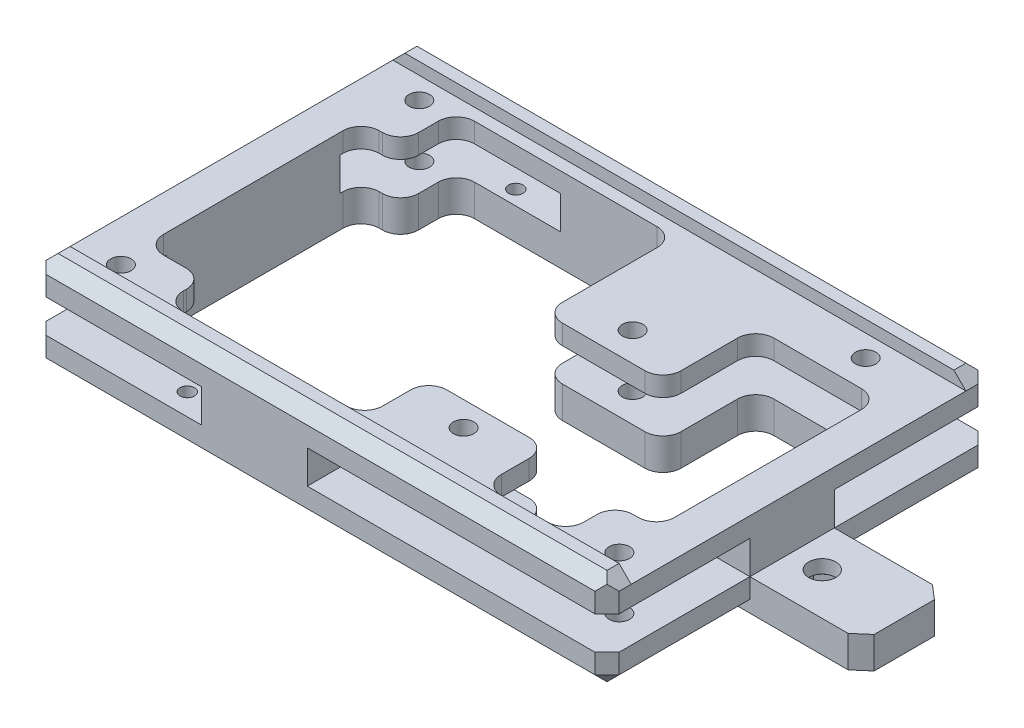
from build123d import *

# Parameters (mm, degrees)
SKETCH2_W                      = 95
SKETCH2_H                      = 63.5
BOSS_EXTRUDE1_DEPTH            = 16
M3_CLEARANCE_HOLE1_D           = 3.4
M3_CLEARANCE_HOLE1_CSINK_D     = 3.45
M3_CLEARANCE_HOLE1_CSINK_ANGLE = 90
CUT_EXTRUDE1_DEPTH             = 16
CUT_EXTRUDE2_DEPTH             = 2.4
FILLET2_SIZE                   = 2
CUT_EXTRUDE3_DEPTH             = 2.75
CUT_EXTRUDE3_DEPTH_BACK        = 2.75
SKETCH12_R                     = 1.7
CUT_EXTRUDE10_DEPTH            = 2.75
CUT_EXTRUDE10_DEPTH_BACK       = 2.75
CUT_EXTRUDE11_DEPTH            = 2.75
CUT_EXTRUDE11_DEPTH_BACK       = 2.75
CUT_EXTRUDE12_DEPTH            = 2.75
CUT_EXTRUDE12_DEPTH_BACK       = 2.75
SKETCH15_R                     = 1.7
CHAMFER1_SIZE                  = 2
CHAMFER2_SIZE                  = 2
SKETCH18_W                     = 17.545315541
SKETCH18_H                     = 5.5
BOSS_EXTRUDE2_DEPTH            = 6
SKETCH40_W                     = 124.310088306
SKETCH40_H                     = 55.5
CUT_EXTRUDE16_DEPTH            = 2
BOSS_EXTRUDE3_DEPTH            = 13.988796219
CUT_EXTRUDE18_DEPTH            = 3
M4_CLEARANCE_HOLE1_D           = 4.5
M4_CLEARANCE_HOLE1_CSINK_D     = 4.55
M4_CLEARANCE_HOLE1_CSINK_ANGLE = 90
BOSS_EXTRUDE4_DEPTH            = 5.25
BOSS_EXTRUDE5_DEPTH            = 13.988796219
M2_CLEARANCE_HOLE1_D           = 2.4
M2_CLEARANCE_HOLE1_DEPTH       = 5.25
M2_CLEARANCE_HOLE1_CSINK_D     = 2.45
M2_CLEARANCE_HOLE1_CSINK_ANGLE = 90
M2_CLEARANCE_HOLE1_TIP         = 0.721032743


with BuildPart() as part:
    # Sketch2 → Boss-Extrude1 (new body)
    with BuildSketch(Plane(origin=(0, 0, 0), x_dir=(1, 0, 0), z_dir=(0, 1, 0))):
        Rectangle(SKETCH2_W, SKETCH2_H)
    extrude(amount=BOSS_EXTRUDE1_DEPTH)

    # M3 Clearance Hole1 (through all)
    with Locations(Plane(origin=(0, 16, 0), x_dir=(1, 0, 0), z_dir=(0, 1, 0))):
        with Locations((-39.536732268, 24.17), (-40.666732268, -24.17), (34.463267732, 24.17), (41.963267732, -24.17), (11.143267732, -19.17), (11.143267732, 8.85)):
            CounterSinkHole(M3_CLEARANCE_HOLE1_D / 2, M3_CLEARANCE_HOLE1_CSINK_D / 2, counter_sink_angle=M3_CLEARANCE_HOLE1_CSINK_ANGLE)

    # Sketch9 → Cut-Extrude1 (cut)
    with BuildSketch(Plane(origin=(0, 16, 0), x_dir=(1, 0, 0), z_dir=(0, 1, 0))):
        with BuildLine():
            Line((-34.974163292, 19.487383717), (-34.974163292, 22.75))
            ThreePointArc((-34.974163292, 22.75), (-34.095483636, 24.871320344), (-31.974163292, 25.75))
            Line((-31.974163292, 25.75), (-1.684765082, 25.75))
            ThreePointArc((-1.684765082, 25.75), (0.436555262, 24.871320344), (1.315234918, 22.75))
            Line((1.315234918, 22.75), (1.315234918, 7.055031971))
            ThreePointArc((1.315234918, 7.055031971), (2.193914574, 4.933711628), (4.315234918, 4.055031971))
            Line((4.315234918, 4.055031971), (17.971300546, 4.055031971))
            ThreePointArc((17.971300546, 4.055031971), (20.09262089, 4.933711628), (20.971300546, 7.055031971))
            Line((20.971300546, 7.055031971), (20.971300546, 16.428287462))
            ThreePointArc((20.971300546, 16.428287462), (21.849980203, 18.549607805), (23.971300546, 19.428287462))
            Line((23.971300546, 19.428287462), (38.5, 19.428287462))
            ThreePointArc((38.5, 19.428287462), (40.621320344, 18.549607805), (41.5, 16.428287462))
            Line((41.5, 16.428287462), (41.5, -14.560508757))
            ThreePointArc((41.5, -14.560508757), (40.621320344, -16.681829101), (38.5, -17.560508757))
            Line((38.5, -17.560508757), (37.647901029, -17.560508757))
            ThreePointArc((37.647901029, -17.560508757), (35.526580685, -18.439188414), (34.647901029, -20.560508757))
            Line((34.647901029, -20.560508757), (34.647901029, -22.75))
            ThreePointArc((34.647901029, -22.75), (33.769221372, -24.871320344), (31.647901029, -25.75))
            Line((31.647901029, -25.75), (23.971300546, -25.75))
            ThreePointArc((23.971300546, -25.75), (21.849980203, -24.871320344), (20.971300546, -22.75))
            Line((20.971300546, -22.75), (20.971300546, -18.118028913))
            ThreePointArc((20.971300546, -18.118028913), (20.09262089, -15.996708569), (17.971300546, -15.118028913))
            Line((17.971300546, -15.118028913), (4.315234918, -15.118028913))
            ThreePointArc((4.315234918, -15.118028913), (2.193914574, -15.996708569), (1.315234918, -18.118028913))
            Line((1.315234918, -18.118028913), (1.315234918, -22.75))
            ThreePointArc((1.315234918, -22.75), (0.436555262, -24.871320344), (-1.684765082, -25.75))
            Line((-1.684765082, -25.75), (-28.730080623, -25.75))
            ThreePointArc((-28.730080623, -25.75), (-30.851400966, -24.871320344), (-31.730080623, -22.75))
            Line((-31.730080623, -22.75), (-31.730080623, -22.252488185))
            ThreePointArc((-31.730080623, -22.252488185), (-32.608760279, -20.131167841), (-34.730080623, -19.252488185))
            Line((-34.730080623, -19.252488185), (-38.5, -19.252488185))
            ThreePointArc((-38.5, -19.252488185), (-40.621320344, -18.373808528), (-41.5, -16.252488185))
            Line((-41.5, -16.252488185), (-41.5, 13.487383717))
            ThreePointArc((-41.5, 13.487383717), (-40.621320344, 15.60870406), (-38.5, 16.487383717))
            Line((-38.5, 16.487383717), (-37.974163292, 16.487383717))
            ThreePointArc((-37.974163292, 16.487383717), (-35.852842949, 17.366063373), (-34.974163292, 19.487383717))
        make_face()
    extrude(amount=-CUT_EXTRUDE1_DEPTH, mode=Mode.SUBTRACT)

    # Sketch10 → Cut-Extrude2 (cut)
    with BuildSketch(Plane.XZ):
        Polygon((-40.666732268, 20.994573519), (-37.916732268, 22.58228676), (-37.916732268, 25.75771324), (-40.666732268, 27.345426481), (-43.416732268, 25.75771324), (-43.416732268, 22.58228676), align=None)
        Polygon((-39.536732268, -27.345426481), (-36.786732268, -25.75771324), (-36.786732268, -22.58228676), (-39.536732268, -20.994573519), (-42.286732268, -22.58228676), (-42.286732268, -25.75771324), align=None)
        Polygon((8.393267732, -10.43771324), (11.143267732, -12.025426481), (13.893267732, -10.43771324), (13.893267732, -7.26228676), (11.143267732, -5.674573519), (8.393267732, -7.26228676), align=None)
        Polygon((8.393267732, 17.58228676), (11.143267732, 15.994573519), (13.893267732, 17.58228676), (13.893267732, 20.75771324), (11.143267732, 22.345426481), (8.393267732, 20.75771324), align=None)
        Polygon((41.963267732, 20.994573519), (44.713267732, 22.58228676), (44.713267732, 25.75771324), (41.963267732, 27.345426481), (39.213267732, 25.75771324), (39.213267732, 22.58228676), align=None)
    extrude(amount=-CUT_EXTRUDE2_DEPTH, mode=Mode.SUBTRACT)

    # Fillet2
    fillet2_edges = [part.edges().sort_by_distance(p)[0] for p in [
        (47.5, 16, 0),
        (0, 16, -31.75),
        (-47.5, 16, 0),
        (0, 16, 31.75),
    ]]
    chamfer(fillet2_edges, length=FILLET2_SIZE)

    # Sketch12 → Cut-Extrude3 (cut, two sides: drawn at the far end of the back side and taken through both)
    with BuildSketch(Plane(origin=(0, 8, 0), x_dir=(1, 0, 0), z_dir=(0, 1, 0)).offset(-CUT_EXTRUDE3_DEPTH_BACK)):
        with BuildLine():
            Line((-31.730080623, -22.252488185), (-31.730080623, -22.75))
            ThreePointArc((-31.730080623, -22.75), (-30.851400966, -24.871320344), (-28.730080623, -25.75))
            Line((-28.730080623, -25.75), (-19.730080623, -25.75))
            Line((-19.730080623, -25.75), (-19.730080623, -31.75))
            Line((-19.730080623, -31.75), (-47.5, -31.75))
            Line((-47.5, -31.75), (-47.5, -15.752488185))
            Line((-47.5, -15.752488185), (-41.5, -15.752488185))
            Line((-41.5, -15.752488185), (-41.5, -16.252488185))
            ThreePointArc((-41.5, -16.252488185), (-40.621320344, -18.373808528), (-38.5, -19.252488185))
            Line((-38.5, -19.252488185), (-34.730080623, -19.252488185))
            ThreePointArc((-34.730080623, -19.252488185), (-32.608760279, -20.131167841), (-31.730080623, -22.252488185))
        make_face()
        with Locations(Location((-40.666732268, -24.17, 0), (0, 0, 270))):
            Circle(SKETCH12_R, mode=Mode.SUBTRACT)
    extrude(amount=CUT_EXTRUDE3_DEPTH + CUT_EXTRUDE3_DEPTH_BACK, mode=Mode.SUBTRACT)

    # Sketch14 → Cut-Extrude10 (cut, two sides: drawn at the far end of the back side and taken through both)
    with BuildSketch(Plane(origin=(0, 8, 0), x_dir=(1, 0, 0), z_dir=(0, 1, 0)).offset(-CUT_EXTRUDE10_DEPTH_BACK)):
        with BuildLine():
            Line((-34.974163292, 22.75), (-34.974163292, 19.487383717))
            ThreePointArc((-34.974163292, 19.487383717), (-35.852842949, 17.366063373), (-37.974163292, 16.487383717))
            Line((-37.974163292, 16.487383717), (-38.5, 16.487383717))
            ThreePointArc((-38.5, 16.487383717), (-40.621320344, 15.60870406), (-41.5, 13.487383717))
            Line((-41.5, 13.487383717), (-41.5, 12.987383717))
            Line((-41.5, 12.987383717), (-47.5, 12.987383717))
            Line((-47.5, 12.987383717), (-47.5, 31.75))
            Line((-47.5, 31.75), (-11.974163292, 31.75))
            Line((-11.974163292, 31.75), (-11.974163292, 25.75))
            Line((-11.974163292, 25.75), (-31.974163292, 25.75))
            ThreePointArc((-31.974163292, 25.75), (-34.095483636, 24.871320344), (-34.974163292, 22.75))
        make_face()
    extrude(amount=CUT_EXTRUDE10_DEPTH + CUT_EXTRUDE10_DEPTH_BACK, mode=Mode.SUBTRACT)

    # Sketch13 → Cut-Extrude11 (cut, two sides: drawn at the far end of the back side and taken through both)
    with BuildSketch(Plane(origin=(0, 8, 0), x_dir=(1, 0, 0), z_dir=(0, 1, 0)).offset(-CUT_EXTRUDE11_DEPTH_BACK)):
        with BuildLine():
            Line((20.971300546, -18.118028913), (20.971300546, -22.75))
            ThreePointArc((20.971300546, -22.75), (21.849980203, -24.871320344), (23.971300546, -25.75))
            Line((23.971300546, -25.75), (31.647901029, -25.75))
            ThreePointArc((31.647901029, -25.75), (33.769221372, -24.871320344), (34.647901029, -22.75))
            Line((34.647901029, -22.75), (34.647901029, -20.560508757))
            ThreePointArc((34.647901029, -20.560508757), (35.526580685, -18.439188414), (37.647901029, -17.560508757))
            Line((37.647901029, -17.560508757), (38.5, -17.560508757))
            ThreePointArc((38.5, -17.560508757), (40.621320344, -16.681829101), (41.5, -14.560508757))
            Line((41.5, -14.560508757), (41.5, -8.060508757))
            Line((41.5, -8.060508757), (47.5, -8.060508757))
            Line((47.5, -8.060508757), (47.5, -31.75))
            Line((47.5, -31.75), (-2.184765082, -31.75))
            Line((-2.184765082, -31.75), (-2.184765082, -25.75))
            Line((-2.184765082, -25.75), (-1.684765082, -25.75))
            ThreePointArc((-1.684765082, -25.75), (0.436555262, -24.871320344), (1.315234918, -22.75))
            Line((1.315234918, -22.75), (1.315234918, -18.118028913))
            ThreePointArc((1.315234918, -18.118028913), (2.193914574, -15.996708569), (4.315234918, -15.118028913))
            Line((4.315234918, -15.118028913), (17.971300546, -15.118028913))
            ThreePointArc((17.971300546, -15.118028913), (20.09262089, -15.996708569), (20.971300546, -18.118028913))
        make_face()
    extrude(amount=CUT_EXTRUDE11_DEPTH + CUT_EXTRUDE11_DEPTH_BACK, mode=Mode.SUBTRACT)

    # Sketch15 → Cut-Extrude12 (cut, two sides: drawn at the far end of the back side and taken through both)
    with BuildSketch(Plane(origin=(0, 8, 0), x_dir=(1, 0, 0), z_dir=(0, 1, 0)).offset(-CUT_EXTRUDE12_DEPTH_BACK)):
        with Locations(Location((-40.666732268, -24.17, 0), (0, 0, 270))):
            Circle(SKETCH15_R)
        with BuildLine():
            Line((38.5, 19.428287462), (23.971300546, 19.428287462))
            ThreePointArc((23.971300546, 19.428287462), (21.849980203, 18.549607805), (20.971300546, 16.428287462))
            Line((20.971300546, 16.428287462), (20.971300546, 7.055031971))
            ThreePointArc((20.971300546, 7.055031971), (20.09262089, 4.933711628), (17.971300546, 4.055031971))
            Line((17.971300546, 4.055031971), (4.315234918, 4.055031971))
            ThreePointArc((4.315234918, 4.055031971), (2.193914574, 4.933711628), (1.315234918, 7.055031971))
            Line((1.315234918, 7.055031971), (1.315234918, 22.75))
            ThreePointArc((1.315234918, 22.75), (0.436555262, 24.871320344), (-1.684765082, 25.75))
            Line((-1.684765082, 25.75), (-12.684765082, 25.75))
            Line((-12.684765082, 25.75), (-12.684765082, 31.75))
            Line((-12.684765082, 31.75), (47.5, 31.75))
            Line((47.5, 31.75), (47.5, 5.928287462))
            Line((47.5, 5.928287462), (41.5, 5.928287462))
            Line((41.5, 5.928287462), (41.5, 16.428287462))
            ThreePointArc((41.5, 16.428287462), (40.621320344, 18.549607805), (38.5, 19.428287462))
        make_face()
    extrude(amount=CUT_EXTRUDE12_DEPTH + CUT_EXTRUDE12_DEPTH_BACK, mode=Mode.SUBTRACT)

    # Chamfer1
    chamfer1_edges = [part.edges().sort_by_distance(p)[0] for p in [
        (-47.5, 2.625, 31.75),
        (-47.5, 2.625, -31.75),
        (47.5, 2.625, 31.75),
        (47.5, 2.625, -31.75),
        (0, 0, -31.75),
        (47.5, 0, 0),
        (0, 0, 31.75),
        (-47.5, 0, 0),
    ]]
    chamfer(chamfer1_edges, length=CHAMFER1_SIZE)

    # Chamfer2
    chamfer2_edges = [part.edges().sort_by_distance(p)[0] for p in [
        (-47.5, 12.375, -31.75),
        (47.5, 12.375, -31.75),
        (47.5, 12.375, 31.75),
        (-47.5, 12.375, 31.75),
    ]]
    chamfer(chamfer2_edges, length=CHAMFER2_SIZE)

    # Sketch18 → Boss-Extrude2 (add)
    with BuildSketch(Plane(origin=(0, 0, -31.75), x_dir=(-1, 0, 0), z_dir=(0, 0, -1))):
        with Locations((8.957422853, 8)):
            Rectangle(SKETCH18_W, SKETCH18_H)
    extrude(amount=-BOSS_EXTRUDE2_DEPTH)

    # Sketch40 → Cut-Extrude16 (cut)
    with BuildSketch(Plane(origin=(0, 16, 0), x_dir=(1, 0, 0), z_dir=(0, 1, 0))):
        Rectangle(SKETCH40_W, SKETCH40_H)
    extrude(amount=-CUT_EXTRUDE16_DEPTH, mode=Mode.SUBTRACT)

    # Sketch43 → Boss-Extrude3 (add)
    with BuildSketch(Plane.XY.offset(8.060508757)):
        Polygon((45.5, 2), (45.5, 0), (57.5, 0), (60.084399262, 5.25), (47.5, 5.25), (47.5, 2), align=None)
    extrude(amount=-BOSS_EXTRUDE3_DEPTH)

    # Sketch48 → Cut-Extrude18 (cut)
    with BuildSketch(Plane.XZ):
        Polygon((52.5, -2.888738696), (55.925, -0.911314024), (55.925, 3.04353532), (52.5, 5.020959992), (49.075, 3.04353532), (49.075, -0.911314024), align=None)
    extrude(amount=-CUT_EXTRUDE18_DEPTH, mode=Mode.SUBTRACT)

    # M4 Clearance Hole1 (through all)
    with Locations(Plane(origin=(0, 3, 0), x_dir=(-1, 0, 0), z_dir=(0, -1, 0))):
        with Locations((-52.5, -1.066110648)):
            CounterSinkHole(M4_CLEARANCE_HOLE1_D / 2, M4_CLEARANCE_HOLE1_CSINK_D / 2, counter_sink_angle=M4_CLEARANCE_HOLE1_CSINK_ANGLE)



with BuildPart() as body_2:
    # Sketch52 → Boss-Extrude4 (new body)
    with BuildSketch(Plane(origin=(0, 5.25, 0), x_dir=(1, 0, 0), z_dir=(0, 1, 0))):
        Polygon((60.084399262, 5.928287462), (63.774399262, 5.928287462), (66.090863637, 3.928889352), (66.090863637, -6.061110648), (63.774399262, -8.060508757), (60.084399262, -8.060508757), align=None)
    extrude(amount=-BOSS_EXTRUDE4_DEPTH)


with BuildPart() as part_1:
    add(part.part)

    add(body_2.part)  # Boss-Extrude5 merges body 2
    # Sketch53 → Boss-Extrude5 (add)
    with BuildSketch(Plane.XY.offset(8.060508757)):
        Polygon((60.084399262, 0), (60.084399262, 5.25), (57.5, 0), align=None)
    extrude(amount=-BOSS_EXTRUDE5_DEPTH)

    # M2 Clearance Hole1
    with Locations(Plane(origin=(0, 0, 0), x_dir=(-1, 0, 0), z_dir=(0, -1, 0))):
        with Locations((27.536732268, 28.17), (25.666732268, -28.17)):
            CounterSinkHole(M2_CLEARANCE_HOLE1_D / 2, M2_CLEARANCE_HOLE1_CSINK_D / 2, depth=M2_CLEARANCE_HOLE1_DEPTH, counter_sink_angle=M2_CLEARANCE_HOLE1_CSINK_ANGLE)
            with Locations((0, 0, -(M2_CLEARANCE_HOLE1_DEPTH + M2_CLEARANCE_HOLE1_TIP / 2))):  # 118° drill point
                Cone(0, M2_CLEARANCE_HOLE1_D / 2, M2_CLEARANCE_HOLE1_TIP, mode=Mode.SUBTRACT)


solid = part_1.part
